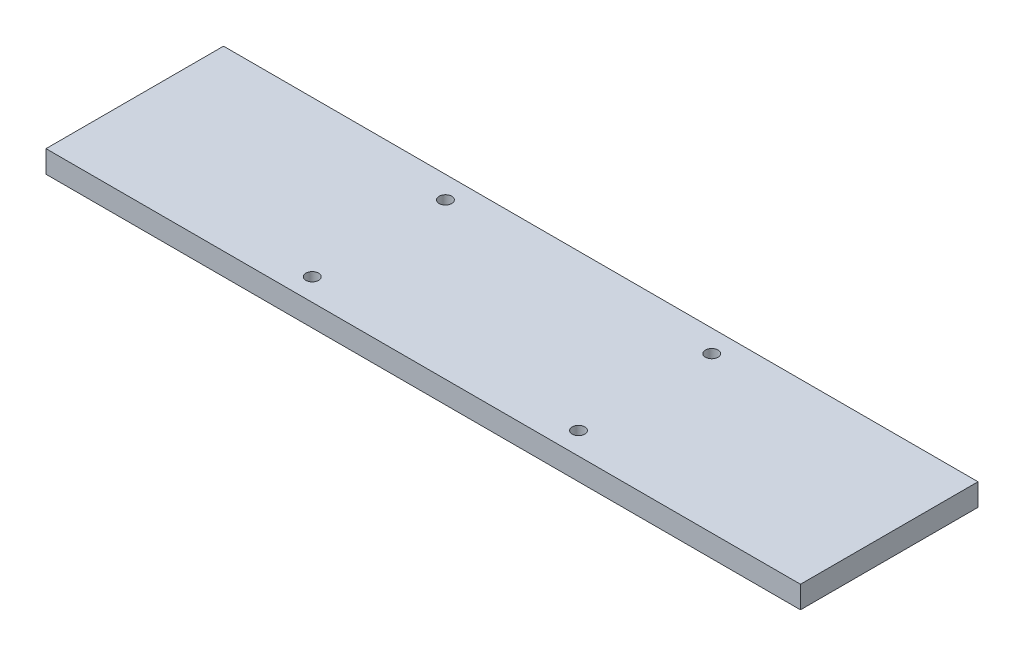
from build123d import *

# Parameters (mm, degrees)
SKETCH1_W           = 215.9
SKETCH1_H           = 50.8
SKETCH1_R           = 1.80975
BOSS_EXTRUDE1_DEPTH = 6.35


with BuildPart() as part:
    # Sketch1 → Boss-Extrude1 (new body)
    with BuildSketch(Plane(origin=(0, 0, 0), x_dir=(1, 0, 0), z_dir=(0, 1, 0))):
        Rectangle(SKETCH1_W, SKETCH1_H)
        with Locations((-38.1, 19.05)):
            Circle(SKETCH1_R, mode=Mode.SUBTRACT)
        with Locations((-38.1, -19.05)):
            Circle(SKETCH1_R, mode=Mode.SUBTRACT)
        with Locations((38.1, 19.05)):
            Circle(SKETCH1_R, mode=Mode.SUBTRACT)
        with Locations((38.1, -19.05)):
            Circle(SKETCH1_R, mode=Mode.SUBTRACT)
    extrude(amount=BOSS_EXTRUDE1_DEPTH)


solid = part.part
